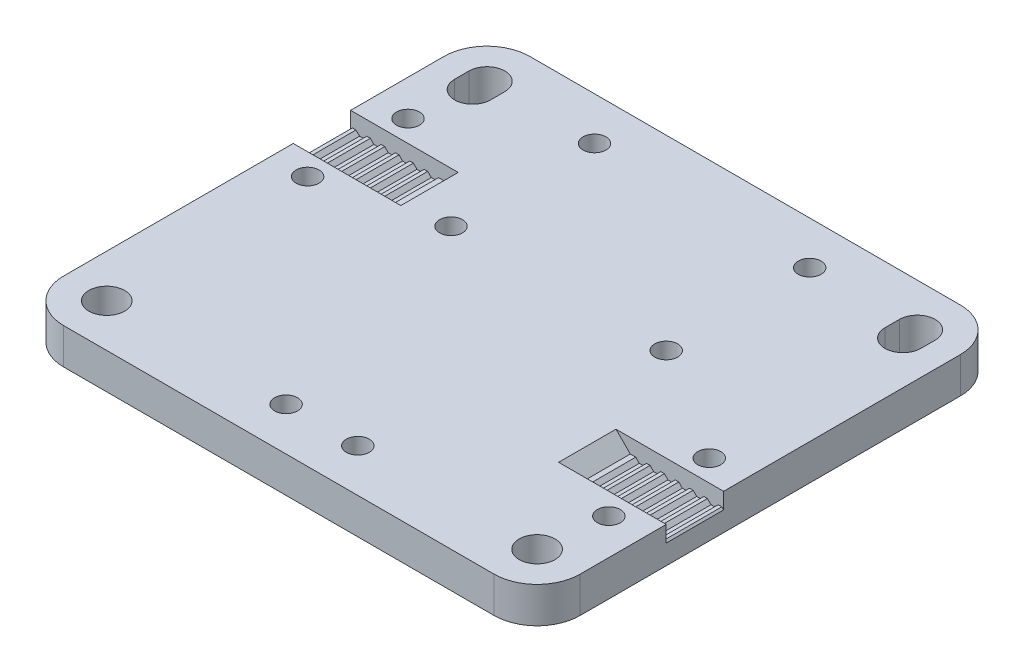
from build123d import *

# Parameters (mm, degrees)
SKETCH1_W           = 72
SKETCH1_H           = 65
SKETCH1_R           = 2.5
SKETCH1_R_2         = 1.6
BOSS_EXTRUDE1_DEPTH = 5
FILLET1_R           = 6
SKETCH2_W           = 15
SKETCH2_H           = 8
CUT_EXTRUDE1_DEPTH  = 2
CHAMFER1_SIZE       = 2
SKETCH3_W           = 0.5
SKETCH3_H           = 8
CUT_EXTRUDE2_DEPTH  = 0.5
CHAMFER2_SIZE       = 0.5
CHAMFER3_SIZE       = 0.25
CUT_EXTRUDE3_DEPTH  = 2.5


with BuildPart() as part:
    # Sketch1 → Boss-Extrude1 (new body)
    with BuildSketch(Plane(origin=(0, 0, 0), x_dir=(1, 0, 0), z_dir=(0, 1, 0))):
        with Locations((36, 32.5)):
            Rectangle(SKETCH1_W, SKETCH1_H)
        with Locations(Location((6, 6, 0), (0, 0, 270))):
            Circle(SKETCH1_R, mode=Mode.SUBTRACT)
        with Locations(Location((66, 6, 0), (0, 0, 90))):
            Circle(SKETCH1_R, mode=Mode.SUBTRACT)
        with Locations(Location((5, 49, 0), (0, 0, 270))):
            Circle(SKETCH1_R_2, mode=Mode.SUBTRACT)
        with Locations(Location((5, 35, 0), (0, 0, 270))):
            Circle(SKETCH1_R_2, mode=Mode.SUBTRACT)
        with Locations(Location((21, 39, 0), (0, 0, 270))):
            Circle(SKETCH1_R_2, mode=Mode.SUBTRACT)
        with Locations(Location((21, 59, 0), (0, 0, 270))):
            Circle(SKETCH1_R_2, mode=Mode.SUBTRACT)
        with Locations(Location((51, 59, 0), (0, 0, 270))):
            Circle(SKETCH1_R_2, mode=Mode.SUBTRACT)
        with Locations(Location((51, 39, 0), (0, 0, 270))):
            Circle(SKETCH1_R_2, mode=Mode.SUBTRACT)
        with Locations(Location((67, 29, 0), (0, 0, 270))):
            Circle(SKETCH1_R_2, mode=Mode.SUBTRACT)
        with Locations(Location((67, 15, 0), (0, 0, 270))):
            Circle(SKETCH1_R_2, mode=Mode.SUBTRACT)
        with Locations(Location((41, 6, 0), (0, 0, 270))):
            Circle(SKETCH1_R_2, mode=Mode.SUBTRACT)
        with Locations(Location((31, 6, 0), (0, 0, 270))):
            Circle(SKETCH1_R_2, mode=Mode.SUBTRACT)
        with BuildLine():
            Line((8.5, 59), (8.5, 57))
            ThreePointArc((8.5, 57), (6, 54.5), (3.5, 57))
            Line((3.5, 57), (3.5, 59))
            ThreePointArc((3.5, 59), (6, 61.5), (8.5, 59))
        make_face(mode=Mode.SUBTRACT)
        with BuildLine():
            Line((68.5, 59), (68.5, 57))
            ThreePointArc((68.5, 57), (66, 54.5), (63.5, 57))
            Line((63.5, 57), (63.5, 59))
            ThreePointArc((63.5, 59), (66, 61.5), (68.5, 59))
        make_face(mode=Mode.SUBTRACT)
    extrude(amount=BOSS_EXTRUDE1_DEPTH)

    # Fillet1
    fillet1_edges = [part.edges().sort_by_distance(p)[0] for p in [
        (0, 2.5, -65),
        (72, 2.5, -65),
        (72, 2.5, 0),
        (0, 2.5, 0),
    ]]
    fillet(fillet1_edges, radius=FILLET1_R)

    # Sketch2 → Cut-Extrude1 (cut)
    with BuildSketch(Plane(origin=(0, 5, 0), x_dir=(1, 0, 0), z_dir=(0, 1, 0))):
        with Locations((7.5, 42)):
            Rectangle(SKETCH2_W, SKETCH2_H)
        with Locations((64.5, 22)):
            Rectangle(SKETCH2_W, SKETCH2_H)
    extrude(amount=-CUT_EXTRUDE1_DEPTH, mode=Mode.SUBTRACT)

    # Chamfer1
    chamfer1_edges = [part.edges().sort_by_distance(p)[0] for p in [
        (57, 3, -22),
        (15, 3, -42),
    ]]
    chamfer(chamfer1_edges, length=CHAMFER1_SIZE - 0.0001)  # a hair under: the kernel refuses the full size

    # Sketch3 → Cut-Extrude2 (cut)
    with BuildSketch(Plane(origin=(0, 3, 0), x_dir=(1, 0, 0), z_dir=(0, 1, 0))):
        with Locations((1.5, 42)):
            Rectangle(SKETCH3_W, SKETCH3_H)
        with Locations((3.5, 42)):
            Rectangle(SKETCH3_W, SKETCH3_H)
        with Locations((5.5, 42)):
            Rectangle(SKETCH3_W, SKETCH3_H)
        with Locations((11.5, 42)):
            Rectangle(SKETCH3_W, SKETCH3_H)
        with Locations((7.5, 42)):
            Rectangle(SKETCH3_W, SKETCH3_H)
        with Locations((9.5, 42)):
            Rectangle(SKETCH3_W, SKETCH3_H)
        with Locations((70.5, 22)):
            Rectangle(SKETCH3_W, SKETCH3_H)
        with Locations((68.5, 22)):
            Rectangle(SKETCH3_W, SKETCH3_H)
        with Locations((66.5, 22)):
            Rectangle(SKETCH3_W, SKETCH3_H)
        with Locations((64.5, 22)):
            Rectangle(SKETCH3_W, SKETCH3_H)
        with Locations((62.5, 22)):
            Rectangle(SKETCH3_W, SKETCH3_H)
        with Locations((60.5, 22)):
            Rectangle(SKETCH3_W, SKETCH3_H)
    extrude(amount=-CUT_EXTRUDE2_DEPTH, mode=Mode.SUBTRACT)

    # Chamfer2
    chamfer2_edges = [part.edges().sort_by_distance(p)[0] for p in [
        (70.75, 3, -22),
        (70.25, 3, -22),
        (68.75, 3, -22),
        (68.25, 3, -22),
        (66.75, 3, -22),
        (66.25, 3, -22),
        (64.75, 3, -22),
        (64.25, 3, -22),
        (62.75, 3, -22),
        (62.25, 3, -22),
        (60.75, 3, -22),
        (60.25, 3, -22),
        (11.75, 3, -42),
        (11.25, 3, -42),
        (9.75, 3, -42),
        (9.25, 3, -42),
        (7.75, 3, -42),
        (7.25, 3, -42),
        (5.75, 3, -42),
        (5.25, 3, -42),
        (3.75, 3, -42),
        (3.25, 3, -42),
        (1.75, 3, -42),
        (1.25, 3, -42),
    ]]
    chamfer(chamfer2_edges, length=CHAMFER2_SIZE - 0.0001)  # a hair under: the kernel refuses the full size

    # Chamfer3
    chamfer3_edges = [part.edges().sort_by_distance(p)[0] for p in [
        (0, 3, -42),
        (72, 3, -22),
    ]]
    chamfer(chamfer3_edges, length=CHAMFER3_SIZE)

    # Sketch4 → Cut-Extrude3 (cut)
    with BuildSketch(Plane.XZ):
        Polygon((8.406366588, -49), (6.703183294, -46.05), (3.296816706, -46.05), (1.593633412, -49), (3.296816706, -51.95), (6.703183294, -51.95), align=None)
        Polygon((8.406366588, -35), (6.703183294, -32.05), (3.296816706, -32.05), (1.593633412, -35), (3.296816706, -37.95), (6.703183294, -37.95), align=None)
        Polygon((24.406366588, -39), (22.703183294, -36.05), (19.296816706, -36.05), (17.593633412, -39), (19.296816706, -41.95), (22.703183294, -41.95), align=None)
        Polygon((54.406366588, -39), (52.703183294, -36.05), (49.296816706, -36.05), (47.593633412, -39), (49.296816706, -41.95), (52.703183294, -41.95), align=None)
        Polygon((54.406366588, -59), (52.703183294, -56.05), (49.296816706, -56.05), (47.593633412, -59), (49.296816706, -61.95), (52.703183294, -61.95), align=None)
        Polygon((24.406366588, -59), (22.703183294, -56.05), (19.296816706, -56.05), (17.593633412, -59), (19.296816706, -61.95), (22.703183294, -61.95), align=None)
        Polygon((34.406366588, -6), (32.703183294, -3.05), (29.296816706, -3.05), (27.593633412, -6), (29.296816706, -8.95), (32.703183294, -8.95), align=None)
        Polygon((44.406366588, -6), (42.703183294, -3.05), (39.296816706, -3.05), (37.593633412, -6), (39.296816706, -8.95), (42.703183294, -8.95), align=None)
        Polygon((70.406366588, -15), (68.703183294, -12.05), (65.296816706, -12.05), (63.593633412, -15), (65.296816706, -17.95), (68.703183294, -17.95), align=None)
        Polygon((70.406366588, -29), (68.703183294, -26.05), (65.296816706, -26.05), (63.593633412, -29), (65.296816706, -31.95), (68.703183294, -31.95), align=None)
    extrude(amount=-CUT_EXTRUDE3_DEPTH, mode=Mode.SUBTRACT)


solid = part.part
